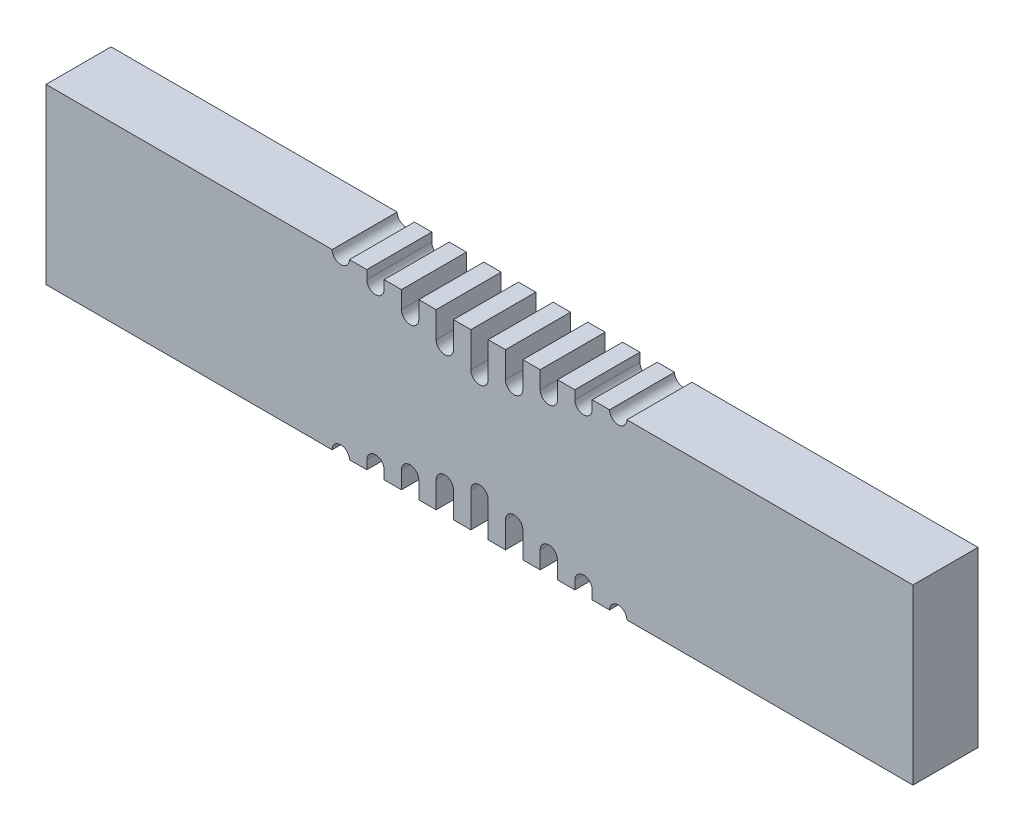
from build123d import *

# Parameters (mm, degrees)
SKETCH1_W                                = 200
SKETCH1_H                                = 40
RECTANGULAR_BAR_40_W_X_200_L_X_15D_DEPTH = 15
NOTCH_CUT_OUT_DEPTH                      = 15
CUT_EXTRUDE1_DEPTH                       = 104.07764064


with BuildPart() as part:
    # Sketch1 → Rectangular Bar (40 W x 200 L x 15D) (new body)
    with BuildSketch(Plane.XY):
        Rectangle(SKETCH1_W, SKETCH1_H)
    extrude(amount=RECTANGULAR_BAR_40_W_X_200_L_X_15D_DEPTH)

    # Notch → Notch cut out (cut)
    with BuildSketch(Plane.XY.offset(15)):
        with BuildLine():
            Line((2, 20), (2, 12))
            ThreePointArc((2, 12), (0, 10), (-2, 12))
            Line((-2, 12), (-2, 20))
            Line((-2, 20), (2, 20))
        make_face()
        with BuildLine():
            Line((-2, -20), (-2, -12))
            ThreePointArc((-2, -12), (0, -10), (2, -12))
            Line((2, -12), (2, -20))
            Line((2, -20), (-2, -20))
        make_face()
    extrude(amount=-NOTCH_CUT_OUT_DEPTH, mode=Mode.SUBTRACT)

    # Sketch2 → Cut-Extrude1 (cut, through all)
    with BuildSketch(Plane.XY.offset(15)):
        with BuildLine():
            Line((6, 20), (6, 14))
            ThreePointArc((6, 14), (8, 12), (10, 14))
            Line((10, 14), (10, 20))
            Line((10, 20), (6, 20))
        make_face()
        with BuildLine():
            Line((14, 20), (14, 16))
            ThreePointArc((14, 16), (16, 14), (18, 16))
            Line((18, 16), (18, 20))
            Line((18, 20), (14, 20))
        make_face()
        with BuildLine():
            Line((22, 20), (22, 18))
            ThreePointArc((22, 18), (24, 16), (26, 18))
            Line((26, 18), (26, 20))
            Line((26, 20), (22, 20))
        make_face()
        with BuildLine():
            Line((30, 20), (34, 20))
            ThreePointArc((34, 20), (32, 18), (30, 20))
        make_face()
        with BuildLine():
            Line((-30, 20), (-34, 20))
            ThreePointArc((-34, 20), (-32, 18), (-30, 20))
        make_face()
        with BuildLine():
            Line((-22, 20), (-26, 20))
            Line((-26, 20), (-26, 18))
            ThreePointArc((-26, 18), (-24, 16), (-22, 18))
            Line((-22, 18), (-22, 20))
        make_face()
        with BuildLine():
            Line((-18, 20), (-18, 16))
            ThreePointArc((-18, 16), (-16, 14), (-14, 16))
            Line((-14, 16), (-14, 20))
            Line((-14, 20), (-18, 20))
        make_face()
        with BuildLine():
            Line((-10, 20), (-10, 14))
            ThreePointArc((-10, 14), (-8, 12), (-6, 14))
            Line((-6, 14), (-6, 20))
            Line((-6, 20), (-10, 20))
        make_face()
        with BuildLine():
            Line((30, -20), (34, -20))
            ThreePointArc((34, -20), (32, -18), (30, -20))
        make_face()
        with BuildLine():
            Line((26, -20), (26, -18))
            ThreePointArc((26, -18), (24, -16), (22, -18))
            Line((22, -18), (22, -20))
            Line((22, -20), (26, -20))
        make_face()
        with BuildLine():
            Line((18, -20), (18, -16))
            ThreePointArc((18, -16), (16, -14), (14, -16))
            Line((14, -16), (14, -20))
            Line((14, -20), (18, -20))
        make_face()
        with BuildLine():
            Line((10, -20), (10, -14))
            ThreePointArc((10, -14), (8, -12), (6, -14))
            Line((6, -14), (6, -20))
            Line((6, -20), (10, -20))
        make_face()
        with BuildLine():
            Line((-6, -20), (-6, -14))
            ThreePointArc((-6, -14), (-8, -12), (-10, -14))
            Line((-10, -14), (-10, -20))
            Line((-10, -20), (-6, -20))
        make_face()
        with BuildLine():
            Line((-14, -20), (-14, -16))
            ThreePointArc((-14, -16), (-16, -14), (-18, -16))
            Line((-18, -16), (-18, -20))
            Line((-18, -20), (-14, -20))
        make_face()
        with BuildLine():
            Line((-30, -20), (-34, -20))
            ThreePointArc((-34, -20), (-32, -18), (-30, -20))
        make_face()
        with BuildLine():
            Line((-22, -20), (-22, -18))
            ThreePointArc((-22, -18), (-24, -16), (-26, -18))
            Line((-26, -18), (-26, -20))
            Line((-26, -20), (-22, -20))
        make_face()
    extrude(amount=-CUT_EXTRUDE1_DEPTH, mode=Mode.SUBTRACT)


solid = part.part
